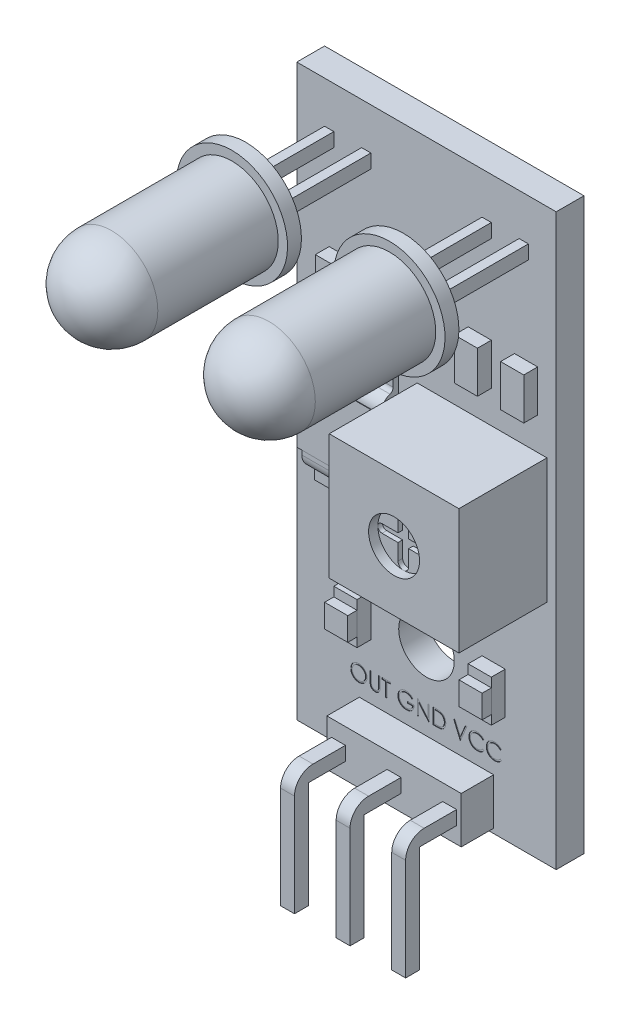
from build123d import *

# Parameters (mm, degrees)
SKETCH1_W               = 14.224
SKETCH1_H               = 31.242
BOSS_EXTRUDE1_DEPTH     = 0.762
SKETCH2_W               = 7.366
SKETCH2_H               = 2.54
BOSS_EXTRUDE2_DEPTH     = 1.778
BOSS_EXTRUDE3_START     = -4.318
SKETCH5_W               = 0.762
SKETCH5_H               = 0.762
BOSS_EXTRUDE3_DEPTH     = 6.35
SKETCH6_W               = 0.762
SKETCH6_H               = 0.762
BOSS_EXTRUDE4_DEPTH     = 6.604
LPATTERN1_COUNT         = 3
LPATTERN1_PITCH         = 3.048
CUT_EXTRUDE1_DEPTH      = 0.0254
CUT_EXTRUDE2_DEPTH      = 23.008773919
CUT_EXTRUDE2_DEPTH_BACK = 23.008773919
SKETCH8_R               = 1.524
SKETCH9_W               = 1.27
SKETCH9_H               = 2.286
BOSS_EXTRUDE5_DEPTH     = 0.762
SKETCH10_W              = 1.27
SKETCH10_H              = 1.27
BOSS_EXTRUDE6_DEPTH     = 0.508
LPATTERN2_START         = 3.048
LPATTERN2_OUTLINE_W     = 1.27
LPATTERN2_OUTLINE_H     = 0.508
LPATTERN2_DEPTH         = 1.27
LPATTERN2_START_2       = -9.779
LPATTERN2_2_OUTLINE_W   = 1.27
LPATTERN2_2_OUTLINE_H   = 0.762
LPATTERN2_2_DEPTH       = 2.286
SKETCH12_W              = 2.286
SKETCH12_H              = 1.27
BOSS_EXTRUDE7_DEPTH     = 0.762
LPATTERN3_COUNT         = 2
LPATTERN3_PITCH         = 5.842
SKETCH16_W              = 7.112
SKETCH16_H              = 6.858
BOSS_EXTRUDE9_DEPTH     = 4.826
SKETCH17_R              = 1.397
CUT_EXTRUDE3_DEPTH      = 0.508
CUT_EXTRUDE4_DEPTH      = 0.254
SKETCH19_W              = 1.27
SKETCH19_H              = 2.286
BOSS_EXTRUDE10_DEPTH    = 0.762
LPATTERN4_COUNT         = 5
LPATTERN4_PITCH         = 2.54
BOSS_EXTRUDE11_START    = -2.794
SKETCH20_W              = 0.508
SKETCH20_H              = 0.762
BOSS_EXTRUDE11_DEPTH    = 8.382
FILLET2_R               = 1.016
SKETCH31_W              = 4.826
SKETCH31_H              = 3.81
BOSS_EXTRUDE14_DEPTH    = 1.016
SKETCH32_W              = 4.318
SKETCH32_H              = 7.112
BOSS_EXTRUDE15_DEPTH    = 0.9906
SKETCH33_W              = 4.318
SKETCH33_H              = 0.762
CUT_EXTRUDE5_DEPTH      = 0.6858
FILLET4_R               = 0.762
FILLET5_R               = 0.254


with BuildPart() as part:
    # Sketch1 → Boss-Extrude1 (new, symmetric)
    with BuildSketch(Plane.XY):
        Rectangle(SKETCH1_W, SKETCH1_H)
    extrude(amount=BOSS_EXTRUDE1_DEPTH, both=True)

    # Sketch2 → Boss-Extrude2 (add)
    with BuildSketch(Plane.XY.offset(0.762)):
        with Locations((0, -14.097)):
            Rectangle(SKETCH2_W, SKETCH2_H)
    extrude(amount=BOSS_EXTRUDE2_DEPTH)

    # Sketch5 → Boss-Extrude3 (add)
    with BuildSketch(Plane.XY.offset(2.54).offset(BOSS_EXTRUDE3_START)):
        with Locations((-3.048, -14.097)):
            Rectangle(SKETCH5_W, SKETCH5_H)
    boss_extrude3 = extrude(amount=BOSS_EXTRUDE3_DEPTH)

    # Sketch6 → Boss-Extrude4 (add)
    with BuildSketch(Plane(origin=(0, -13.716, 0), x_dir=(1, 0, 0), z_dir=(0, 1, 0))):
        with Locations((-3.048, -4.953)):
            Rectangle(SKETCH6_W, SKETCH6_H)
    boss_extrude4 = extrude(amount=-BOSS_EXTRUDE4_DEPTH)

    # LPattern1: Boss-Extrude3, Boss-Extrude4 ×3
    with Locations(*[(i * LPATTERN1_PITCH, 0, 0) for i in range(1, LPATTERN1_COUNT)]):
        add(boss_extrude3)
        add(boss_extrude4)

    # Sketch7 → Cut-Extrude1 (cut)
    # profile 1 of 9: a face of its own
    with BuildSketch(Plane.XY.offset(0.762)):
        with BuildLine():
            add(Edge.make_bspline(
                [(-3.713008127, -11.244319932), (-3.697330739, -11.244717014), (-3.666539056, -11.245496915), (-3.621284752, -11.251466907), (-3.578081752, -11.261795124), (-3.536578123, -11.275550549), (-3.497270302, -11.293900084), (-3.459862421, -11.316079156), (-3.424443486, -11.342320125), (-3.391490888, -11.372420145), (-3.361335781, -11.405170043), (-3.334768379, -11.440119934), (-3.312502912, -11.477058498), (-3.294218352, -11.515874733), (-3.279873738, -11.556480855), (-3.269975227, -11.599093343), (-3.263652285, -11.643436099), (-3.262913078, -11.67368069), (-3.262538087, -11.689023413)],
                knots=[0, 0, 0, 0, 1.065120563, 2.091984664, 3.0946048, 4.079830382, 5.057816894, 6.036188127, 7.030412546, 8.04752943, 9.064399622, 10.05169764, 11.02544977, 11.989514704, 12.962713494, 13.945757189, 14.957906945, 16, 16, 16, 16], degree=3))
            add(Edge.make_bspline(
                [(-3.262538087, -11.689023413), (-3.262913023, -11.704253118), (-3.263652065, -11.73427263), (-3.269982416, -11.778333992), (-3.279910429, -11.820689261), (-3.294085143, -11.861267729), (-3.312282543, -11.900112202), (-3.334696268, -11.937120471), (-3.361098044, -11.972304668), (-3.391144269, -12.005279348), (-3.423898423, -12.035516828), (-3.459030312, -12.06186482), (-3.495749836, -12.08453713), (-3.534529514, -12.102627655), (-3.574855042, -12.117086766), (-3.617087333, -12.12694502), (-3.661028495, -12.133303981), (-3.690993478, -12.134034174), (-3.70622394, -12.134405313)],
                knots=[0, 0, 0, 0, 1.043624062, 2.057103931, 3.04512605, 4.022047818, 4.998200453, 5.980619268, 6.982898556, 8.009068085, 9.034988726, 10.034168286, 11.015286542, 11.987931943, 12.962482838, 13.94673481, 14.956375938, 16, 16, 16, 16], degree=3))
            add(Edge.make_bspline(
                [(-3.70622394, -12.134405313), (-3.721566583, -12.134030509), (-3.751811017, -12.133291671), (-3.796209495, -12.126958265), (-3.838851917, -12.117054369), (-3.879616337, -12.10290066), (-3.918525487, -12.084608493), (-3.955655465, -12.062303817), (-3.990857237, -12.035837711), (-4.023838951, -12.005801229), (-4.054016373, -11.97310259), (-4.080325781, -11.938066497), (-4.102635473, -11.901380324), (-4.12086622, -11.86294226), (-4.135299336, -11.822938124), (-4.145146024, -11.781101068), (-4.151516816, -11.737669611), (-4.152250959, -11.708098475), (-4.152623468, -11.693093926)],
                knots=[0, 0, 0, 0, 1.053102029, 2.075944431, 3.073151272, 4.055350789, 5.033113405, 6.020478099, 7.024410459, 8.052272461, 9.079885166, 10.07527673, 11.055994387, 12.023226415, 12.992069828, 13.970394897, 14.97016774, 16, 16, 16, 16], degree=3))
            add(Edge.make_bspline(
                [(-4.152623468, -11.693093926), (-4.152494137, -11.683022786), (-4.152237107, -11.663007558), (-4.149142736, -11.633285545), (-4.144652572, -11.604041522), (-4.138217444, -11.575358648), (-4.129801175, -11.547307137), (-4.119870495, -11.519693526), (-4.107741429, -11.492797657), (-4.094030111, -11.466492115), (-4.07872678, -11.441186967), (-4.061823505, -11.417267527), (-4.043913999, -11.394533079), (-4.024280189, -11.373572758), (-4.003569166, -11.353776809), (-3.981444951, -11.335449449), (-3.958042544, -11.318425415), (-3.933261247, -11.303083734), (-3.907711685, -11.289208288), (-3.881373877, -11.277301289), (-3.854605528, -11.267081766), (-3.827281264, -11.258798748), (-3.799473643, -11.252259571), (-3.771121977, -11.247806745), (-3.74224885, -11.244704481), (-3.722796971, -11.244448667), (-3.713008127, -11.244319932)],
                knots=[0, 0, 0, 0, 1.037015668, 2.060948919, 3.074880161, 4.083647147, 5.086022904, 6.090072063, 7.104153813, 8.122640571, 9.144368836, 10.147691507, 11.138137339, 12.123020368, 13.103399296, 14.087645067, 15.080126199, 16.082011238, 17.087798457, 18.072939717, 19.057185487, 20.037253025, 21.01195951, 21.997135196, 22.992090687, 24, 24, 24, 24], degree=3))
        make_face()
        with BuildLine():
            add(Edge.make_bspline(
                [(-3.709276824, -11.33115753), (-3.717311601, -11.331255475), (-3.733304343, -11.331450428), (-3.757079838, -11.33401842), (-3.780542646, -11.337678412), (-3.803697613, -11.342899084), (-3.826447856, -11.350012064), (-3.849005435, -11.35819834), (-3.871164647, -11.368169917), (-3.89285234, -11.379436075), (-3.913877509, -11.391906003), (-3.93371677, -11.405687743), (-3.952421484, -11.420458097), (-3.969945853, -11.436251534), (-3.986238421, -11.453148484), (-4.001619861, -11.470892786), (-4.015473644, -11.489991622), (-4.028170154, -11.50992709), (-4.039531897, -11.530673223), (-4.049635134, -11.552011606), (-4.05789957, -11.574116302), (-4.064639611, -11.596747496), (-4.070227564, -11.619869346), (-4.07376758, -11.643657253), (-4.076363789, -11.667991687), (-4.076547599, -11.68443682), (-4.076640569, -11.692754716)],
                knots=[0, 0, 0, 0, 1.008559885, 2.007477868, 2.99961109, 3.989939068, 4.984837346, 5.991145699, 7.001802488, 8.033829008, 9.059044045, 10.069351652, 11.065060232, 12.050310815, 13.029377138, 14.011219647, 14.996725999, 15.989392538, 16.977580475, 17.965360261, 18.951710183, 19.937753436, 20.929683414, 21.935841486, 22.955955122, 24, 24, 24, 24], degree=3))
            add(Edge.make_bspline(
                [(-4.076640569, -11.692754716), (-4.076332174, -11.704985957), (-4.075725466, -11.729048591), (-4.070413825, -11.764310596), (-4.06223213, -11.798198616), (-4.050171396, -11.830527227), (-4.035088487, -11.861574317), (-4.016455318, -11.891064465), (-3.994379312, -11.919005642), (-3.969302614, -11.94520278), (-3.941889315, -11.969114049), (-3.912780257, -11.990102528), (-3.882287292, -12.007860816), (-3.850330902, -12.022327946), (-3.817081691, -12.033791748), (-3.782325411, -12.041648483), (-3.746293589, -12.046819307), (-3.721732842, -12.047315878), (-3.709276824, -12.047567715)],
                knots=[0, 0, 0, 0, 1.032063989, 2.030389145, 3.003944642, 3.970395727, 4.937377036, 5.913328081, 6.909231446, 7.93887556, 8.970685674, 9.976071282, 10.964166581, 11.944589148, 12.933237628, 13.927779006, 14.949070134, 16, 16, 16, 16], degree=3))
            add(Edge.make_bspline(
                [(-3.709276824, -12.047567715), (-3.700904622, -12.047452688), (-3.68430003, -12.047224556), (-3.659602639, -12.044926781), (-3.635350187, -12.041242119), (-3.611576689, -12.03593699), (-3.588309127, -12.029297381), (-3.565450387, -12.021409417), (-3.543243945, -12.011568441), (-3.521409663, -12.000695318), (-3.500510003, -11.988300081), (-3.480558781, -11.974986092), (-3.462058879, -11.960237494), (-3.44454762, -11.944678711), (-3.428188161, -11.927996029), (-3.413091132, -11.910211139), (-3.399307368, -11.891211782), (-3.38661568, -11.871306552), (-3.375293749, -11.850503651), (-3.365429092, -11.829087903), (-3.357060127, -11.807112041), (-3.35030409, -11.784544367), (-3.345009893, -11.761427745), (-3.341361989, -11.737731222), (-3.338810272, -11.713502203), (-3.338617939, -11.697114643), (-3.338520985, -11.688853809)],
                knots=[0, 0, 0, 0, 1.047197238, 2.076906641, 3.100256066, 4.114471768, 5.12198147, 6.126382909, 7.136867548, 8.15857795, 9.17633901, 10.174870724, 11.156907918, 12.133735059, 13.104061851, 14.077631395, 15.04955518, 16.038496417, 17.029181396, 18.010275684, 18.986308667, 19.968651475, 20.955262928, 21.950658345, 22.966943676, 24, 24, 24, 24], degree=3))
            add(Edge.make_bspline(
                [(-3.338520985, -11.688853809), (-3.338618016, -11.680649487), (-3.338810495, -11.664374705), (-3.34136077, -11.640314662), (-3.345013747, -11.616788649), (-3.350278249, -11.593889027), (-3.357063714, -11.571609957), (-3.365430553, -11.549972365), (-3.37529671, -11.528895642), (-3.386619842, -11.508431881), (-3.399347859, -11.488795327), (-3.413255988, -11.470022936), (-3.428584366, -11.452467246), (-3.444895041, -11.435694855), (-3.462595425, -11.420063481), (-3.481605338, -11.40556794), (-3.501693997, -11.391858406), (-3.522964012, -11.37949089), (-3.544915404, -11.368069544), (-3.567440112, -11.358284255), (-3.590282959, -11.349969476), (-3.613385856, -11.342877563), (-3.63694326, -11.337698859), (-3.660795993, -11.334015122), (-3.684911055, -11.331451322), (-3.701129127, -11.331255772), (-3.709276824, -11.33115753)],
                knots=[0, 0, 0, 0, 1.02996197, 2.043119294, 3.035359645, 4.018872909, 4.991431989, 5.957985074, 6.929999688, 7.912076566, 8.892894881, 9.867085534, 10.843653904, 11.817741046, 12.803660682, 13.806313499, 14.818574707, 15.856120519, 16.894564902, 17.924820532, 18.937903209, 19.946497019, 20.957711757, 21.963978472, 22.977135795, 24, 24, 24, 24], degree=3))
        make_face(mode=Mode.SUBTRACT)
    # profile 2 of 9: a face of its own
    with BuildSketch(Plane.XY.offset(0.762)):
        with BuildLine():
            Line((-3.08886289, -11.266029332), (-3.012879992, -11.266029332))
            Line((-3.012879992, -11.266029332), (-3.012879992, -11.773316941))
            add(Edge.make_bspline(
                [(-3.012879992, -11.773316941), (-3.0128913, -11.780496852), (-3.012912758, -11.794121969), (-3.012769426, -11.813515061), (-3.012368017, -11.830756207), (-3.012114946, -11.845911864), (-3.011551953, -11.85891249), (-3.011092806, -11.869828516), (-3.010502424, -11.878608256), (-3.009792889, -11.883732022), (-3.009487898, -11.885934451)],
                knots=[0, 0, 0, 0, 1.528628734, 2.90083645, 4.128790002, 5.200304208, 6.127813768, 6.898992206, 7.526736466, 8, 8, 8, 8], degree=3))
            add(Edge.make_bspline(
                [(-3.009487898, -11.885934451), (-3.008235447, -11.893880239), (-3.005801114, -11.909324098), (-2.999597134, -11.931315242), (-2.990932711, -11.95113485), (-2.980665538, -11.969401389), (-2.967135174, -11.985606432), (-2.950926701, -12.000534773), (-2.931289414, -12.013590809), (-2.909454946, -12.025529004), (-2.885921186, -12.035124175), (-2.86187313, -12.042379712), (-2.837672259, -12.046801465), (-2.821470408, -12.047313465), (-2.813424884, -12.047567715)],
                knots=[0, 0, 0, 0, 1.035780045, 2.013197591, 2.933192213, 3.817615948, 4.702609284, 5.640816605, 6.646850145, 7.73207398, 8.84249596, 9.914020372, 10.964143139, 12, 12, 12, 12], degree=3))
            add(Edge.make_bspline(
                [(-2.813424884, -12.047567715), (-2.806517599, -12.047307946), (-2.792742923, -12.046789907), (-2.772276227, -12.043581904), (-2.75234325, -12.037800244), (-2.732845564, -12.03033996), (-2.714569423, -12.020482925), (-2.69750463, -12.009096266), (-2.682273356, -11.995740493), (-2.668373994, -11.98096003), (-2.656270306, -11.964283166), (-2.645778621, -11.946073028), (-2.637184731, -11.926055569), (-2.632940869, -11.911987739), (-2.630760639, -11.904760571)],
                knots=[0, 0, 0, 0, 0.994687771, 1.983630487, 2.973142513, 3.978332533, 4.983357753, 5.956394766, 6.925816176, 7.893390482, 8.871859704, 9.88551698, 10.913711441, 12, 12, 12, 12], degree=3))
            add(Edge.make_bspline(
                [(-2.630760639, -11.904760571), (-2.630034895, -11.901773392), (-2.628417643, -11.895116755), (-2.626906454, -11.883863034), (-2.625332494, -11.870585037), (-2.624240398, -11.855187362), (-2.623175722, -11.837721604), (-2.62253877, -11.818096778), (-2.622244364, -11.796384144), (-2.622156629, -11.781231918), (-2.6221108, -11.773316941)],
                knots=[0, 0, 0, 0, 0.558680831, 1.244966039, 2.062412453, 2.990489873, 4.051219941, 5.244515665, 6.560634259, 8, 8, 8, 8], degree=3))
            Line((-2.6221108, -11.773316941), (-2.6221108, -11.266029332))
            Line((-2.6221108, -11.266029332), (-2.546127902, -11.266029332))
            Line((-2.546127902, -11.266029332), (-2.546127902, -11.777387454))
            add(Edge.make_bspline(
                [(-2.546127902, -11.777387454), (-2.546189375, -11.786603632), (-2.546309343, -11.804589564), (-2.547349673, -11.830945414), (-2.549008414, -11.85594699), (-2.551352008, -11.879597653), (-2.55445734, -11.901812771), (-2.557910583, -11.922787065), (-2.562308299, -11.942369977), (-2.567444759, -11.960714199), (-2.573316645, -11.978176216), (-2.580922408, -11.994748775), (-2.589491762, -12.010935685), (-2.599655306, -12.026492121), (-2.611075963, -12.041486962), (-2.624006178, -12.05582927), (-2.638018307, -12.069748238), (-2.653345284, -12.082886826), (-2.669734457, -12.094935781), (-2.687137074, -12.105530669), (-2.705419453, -12.114486858), (-2.72453407, -12.121859128), (-2.744489083, -12.127402278), (-2.765284994, -12.13153284), (-2.78696914, -12.133879871), (-2.801716779, -12.134228681), (-2.809184767, -12.134405313)],
                knots=[0, 0, 0, 0, 1.316592851, 2.569410997, 3.76748051, 4.895814652, 5.963796859, 6.97159953, 7.931736103, 8.829262218, 9.692595152, 10.560224239, 11.431080259, 12.30701507, 13.211635791, 14.121146779, 15.063487852, 16.031507147, 17.00238618, 17.966455255, 18.938106653, 19.907068911, 20.888905087, 21.893141452, 22.933117798, 24, 24, 24, 24], degree=3))
            add(Edge.make_bspline(
                [(-2.809184767, -12.134405313), (-2.817329482, -12.134215475), (-2.833309385, -12.133843012), (-2.856855924, -12.131708747), (-2.87942907, -12.127688679), (-2.901267233, -12.122569988), (-2.922073096, -12.115510304), (-2.942125413, -12.107261806), (-2.961080749, -12.097131498), (-2.979246616, -12.085860336), (-2.996137556, -12.073178568), (-3.011643021, -12.059356089), (-3.025788611, -12.044614323), (-3.038335895, -12.028793664), (-3.049492755, -12.012017158), (-3.059103682, -11.994237344), (-3.067355837, -11.975461105), (-3.071614949, -11.96240957), (-3.073768074, -11.955811581)],
                knots=[0, 0, 0, 0, 1.13879206, 2.234305948, 3.301075583, 4.341971843, 5.366689343, 6.369221514, 7.369726634, 8.367512178, 9.355451585, 10.318319045, 11.268648973, 12.207971039, 13.137398894, 14.081662264, 15.030215811, 16, 16, 16, 16], degree=3))
            add(Edge.make_bspline(
                [(-3.073768074, -11.955811581), (-3.075020453, -11.951304273), (-3.077736891, -11.941527821), (-3.080645867, -11.925347663), (-3.083091302, -11.90671739), (-3.085390742, -11.885635726), (-3.086747575, -11.862086332), (-3.087937127, -11.836079416), (-3.088871271, -11.807583531), (-3.088865762, -11.787734155), (-3.08886289, -11.777387454)],
                knots=[0, 0, 0, 0, 0.625038921, 1.35572334, 2.194682327, 3.136881307, 4.189498639, 5.346923369, 6.617055217, 8, 8, 8, 8], degree=3))
            Line((-3.08886289, -11.777387454), (-3.08886289, -11.266029332))
        make_face()
    # profile 3 of 9: a face of its own
    with BuildSketch(Plane.XY.offset(0.762)):
        Polygon((-2.426726205, -11.35286693), (-2.426726205, -11.266029332), (-1.981683514, -11.266029332), (-1.981683514, -11.35286693), (-2.16621341, -11.35286693), (-2.16621341, -12.112695914), (-2.242196308, -12.112695914), (-2.242196308, -11.35286693), align=None)
    # profile 4 of 9: a face of its own
    with BuildSketch(Plane.XY.offset(0.762)):
        with BuildLine():
            Line((-0.733393041, -11.410532522), (-0.798521239, -11.472268627))
            add(Edge.make_bspline(
                [(-0.798521239, -11.472268627), (-0.810306569, -11.461181924), (-0.833596201, -11.439272887), (-0.871565627, -11.410846421), (-0.911180826, -11.386494814), (-0.952235083, -11.366681308), (-0.99371172, -11.350872165), (-1.0350602, -11.339616788), (-1.075856395, -11.33243886), (-1.102990176, -11.331580493), (-1.116360417, -11.33115753)],
                knots=[0, 0, 0, 0, 1.08915593, 2.152340314, 3.188132944, 4.216796309, 5.218260357, 6.173443236, 7.099959455, 8, 8, 8, 8], degree=3))
            add(Edge.make_bspline(
                [(-1.116360417, -11.33115753), (-1.124564543, -11.331257583), (-1.140951519, -11.33145743), (-1.165292444, -11.334008126), (-1.189378085, -11.337676578), (-1.213162975, -11.342984423), (-1.23669336, -11.349711566), (-1.259887402, -11.358126334), (-1.282788368, -11.36793684), (-1.305180541, -11.379273094), (-1.326889194, -11.391726313), (-1.347392274, -11.405526625), (-1.366820466, -11.420231722), (-1.384808605, -11.436209767), (-1.401460163, -11.453316027), (-1.417171482, -11.471232292), (-1.431389988, -11.490448048), (-1.444232992, -11.51060975), (-1.455689992, -11.531363287), (-1.465803704, -11.552508903), (-1.474293856, -11.573976462), (-1.481011418, -11.595792901), (-1.486553614, -11.617789442), (-1.49045254, -11.640118391), (-1.492650661, -11.662803657), (-1.493030882, -11.677994612), (-1.493222024, -11.68563132)],
                knots=[0, 0, 0, 0, 1.02818874, 2.053710826, 3.065248034, 4.081641283, 5.106893873, 6.131558223, 7.173050175, 8.228653731, 9.27666206, 10.308777013, 11.325269123, 12.329503258, 13.32196095, 14.316845687, 15.314881793, 16.315733098, 17.311955233, 18.285320748, 19.252783886, 20.203351036, 21.145449891, 22.095197417, 23.042428769, 24, 24, 24, 24], degree=3))
            add(Edge.make_bspline(
                [(-1.493222024, -11.68563132), (-1.493039213, -11.693437783), (-1.492674088, -11.709029393), (-1.490337211, -11.732299195), (-1.486000285, -11.755223395), (-1.480202382, -11.777877322), (-1.472949881, -11.800299774), (-1.463909256, -11.822393541), (-1.453201198, -11.844157805), (-1.440806833, -11.865396464), (-1.427215124, -11.886084889), (-1.411988895, -11.905572619), (-1.395815003, -11.924119159), (-1.378104213, -11.941312723), (-1.35942444, -11.957613207), (-1.339217587, -11.972571513), (-1.317880994, -11.986475767), (-1.295382109, -11.999150734), (-1.271965057, -12.01047394), (-1.247954378, -12.020542958), (-1.223273366, -12.028835292), (-1.198051728, -12.035593652), (-1.172319529, -12.041133342), (-1.145946155, -12.044697199), (-1.119125521, -12.047283362), (-1.101045892, -12.047472451), (-1.091937342, -12.047567715)],
                knots=[0, 0, 0, 0, 0.93586088, 1.869166235, 2.799637598, 3.729985548, 4.670839027, 5.622275134, 6.589130586, 7.576015415, 8.568469353, 9.55398029, 10.53834874, 11.515998671, 12.510579167, 13.508179873, 14.527009472, 15.561807829, 16.601455013, 17.643573243, 18.680854198, 19.719860599, 20.772568776, 21.833555941, 22.908541556, 24, 24, 24, 24], degree=3))
            add(Edge.make_bspline(
                [(-1.091937342, -12.047567715), (-1.080960105, -12.04733825), (-1.059404516, -12.046887658), (-1.027718275, -12.043379969), (-0.997285917, -12.037901602), (-0.968192952, -12.029878615), (-0.940405592, -12.019645156), (-0.913821969, -12.00730913), (-0.88865138, -11.992397382), (-0.864818157, -11.975567134), (-0.842863564, -11.956815929), (-0.823062663, -11.936581939), (-0.80573128, -11.91496338), (-0.790611097, -11.892087582), (-0.778102529, -11.867765196), (-0.767835416, -11.842115417), (-0.759965458, -11.815126708), (-0.756734827, -11.796477877), (-0.75510244, -11.787054921)],
                knots=[0, 0, 0, 0, 1.13008108, 2.219097802, 3.278683437, 4.311054135, 5.322181354, 6.324827112, 7.324222904, 8.330512327, 9.32562643, 10.293043162, 11.24128371, 12.174520618, 13.111833804, 14.052305215, 15.015860969, 16, 16, 16, 16], degree=3))
            Line((-0.75510244, -11.787054921), (-1.037324634, -11.787054921))
            Line((-1.037324634, -11.787054921), (-1.037324634, -11.700217322))
            Line((-1.037324634, -11.700217322), (-0.679119542, -11.700217322))
            add(Edge.make_bspline(
                [(-0.679119542, -11.700217322), (-0.679532194, -11.716402561), (-0.680339831, -11.748079996), (-0.686004977, -11.79427661), (-0.695152971, -11.837909377), (-0.707649845, -11.879024249), (-0.723827292, -11.917562962), (-0.743511692, -11.953564644), (-0.767018089, -11.986796714), (-0.793509183, -12.01753047), (-0.823239265, -12.044945343), (-0.855405004, -12.069040492), (-0.890059544, -12.089336932), (-0.927170103, -12.105849509), (-0.966615194, -12.118736741), (-1.008486094, -12.127873864), (-1.052726019, -12.13334816), (-1.083045555, -12.134047598), (-1.098551925, -12.134405313)],
                knots=[0, 0, 0, 0, 1.140356446, 2.231883559, 3.274166699, 4.278491846, 5.25512956, 6.21435461, 7.1637429, 8.11826594, 9.068280886, 10.0076534, 10.945064095, 11.891975133, 12.864533718, 13.863980011, 14.907571808, 16, 16, 16, 16], degree=3))
            add(Edge.make_bspline(
                [(-1.098551925, -12.134405313), (-1.108109614, -12.13426764), (-1.126960457, -12.133996104), (-1.154801498, -12.132066346), (-1.1818749, -12.129095617), (-1.208176721, -12.124609463), (-1.233803708, -12.119114681), (-1.258627871, -12.112078466), (-1.282743776, -12.103933848), (-1.306188696, -12.094669943), (-1.328749832, -12.083936229), (-1.350527673, -12.072007994), (-1.3716426, -12.058946744), (-1.391950785, -12.044526598), (-1.41155804, -12.028855414), (-1.430337937, -12.011901782), (-1.448395613, -11.993717532), (-1.45970719, -11.980804896), (-1.465406856, -11.974298492)],
                knots=[0, 0, 0, 0, 1.107784379, 2.184907829, 3.233506516, 4.263428166, 5.276301166, 6.270063455, 7.25232949, 8.225834625, 9.190232166, 10.146266622, 11.1027726, 12.066435141, 13.031522626, 14.010570082, 14.99756817, 16, 16, 16, 16], degree=3))
            add(Edge.make_bspline(
                [(-1.465406856, -11.974298492), (-1.473676595, -11.963976258), (-1.490078804, -11.943503131), (-1.511191803, -11.910700862), (-1.529189855, -11.876736986), (-1.543793117, -11.841516956), (-1.555196044, -11.805073714), (-1.563373936, -11.767453828), (-1.568165414, -11.728608855), (-1.568855698, -11.702322212), (-1.569204923, -11.689023413)],
                knots=[0, 0, 0, 0, 1.023165419, 2.029347347, 3.013907458, 3.994755782, 4.975994455, 5.96558838, 6.970761222, 8, 8, 8, 8], degree=3))
            add(Edge.make_bspline(
                [(-1.569204923, -11.689023413), (-1.569076172, -11.679065102), (-1.568820306, -11.659275043), (-1.565717753, -11.629893944), (-1.561266363, -11.601034542), (-1.554723552, -11.572720425), (-1.546475504, -11.544932685), (-1.536181614, -11.517658418), (-1.524196469, -11.49088153), (-1.510266265, -11.46478633), (-1.494763931, -11.439719094), (-1.477939403, -11.415780733), (-1.459553772, -11.39340719), (-1.439907285, -11.372315117), (-1.418765539, -11.352769493), (-1.396326595, -11.334589357), (-1.37257316, -11.317750324), (-1.347430506, -11.302517622), (-1.321273907, -11.288834615), (-1.294166062, -11.276838749), (-1.266115245, -11.266924691), (-1.237331611, -11.258512749), (-1.207597285, -11.252292135), (-1.177128044, -11.247780915), (-1.145765067, -11.244694065), (-1.124565497, -11.244445809), (-1.113816346, -11.244319932)],
                knots=[0, 0, 0, 0, 1.008945113, 2.00506715, 2.99143336, 3.967273523, 4.948097931, 5.927297278, 6.919902385, 7.919676788, 8.923139349, 9.905703106, 10.883022732, 11.856032218, 12.825136022, 13.798837087, 14.781400844, 15.773989409, 16.776158564, 17.77167057, 18.775803737, 19.789618931, 20.80898985, 21.851988756, 22.910860228, 24, 24, 24, 24], degree=3))
            add(Edge.make_bspline(
                [(-1.113816346, -11.244319932), (-1.105050144, -11.244460114), (-1.087667794, -11.244738078), (-1.061801952, -11.246664764), (-1.036335911, -11.249718541), (-1.011231911, -11.253885782), (-0.98657544, -11.25956176), (-0.962296259, -11.26635403), (-0.938359171, -11.274262337), (-0.914839197, -11.283693923), (-0.89157819, -11.294399085), (-0.868446814, -11.306449188), (-0.845524103, -11.320050283), (-0.822770306, -11.335242756), (-0.800041939, -11.351765676), (-0.777698494, -11.37009161), (-0.755200642, -11.389497875), (-0.740734299, -11.403451469), (-0.733393041, -11.410532522)],
                knots=[0, 0, 0, 0, 0.985871117, 1.954866573, 2.915460327, 3.869826059, 4.81536089, 5.759505086, 6.70452669, 7.649098992, 8.607881297, 9.583363685, 10.581137262, 11.603961102, 12.659522466, 13.73993555, 14.853081303, 16, 16, 16, 16], degree=3))
        make_face()
    # profile 5 of 9: a face of its own
    with BuildSketch(Plane.XY.offset(0.762)):
        Polygon((-0.505444345, -12.112695914), (-0.505444345, -11.266029332), (-0.489501505, -11.266029332), (0.069854742, -11.932406135), (0.069854742, -11.266029332), (0.145837641, -11.266029332), (0.145837641, -12.112695914), (0.128537963, -12.112695914), (-0.429461447, -11.447845553), (-0.429461447, -12.112695914), align=None)
    # profile 6 of 9: a face of its own
    with BuildSketch(Plane.XY.offset(0.762)):
        with BuildLine():
            Line((0.362931636, -12.112695914), (0.362931636, -11.266029332))
            Line((0.362931636, -11.266029332), (0.533893158, -11.266029332))
            add(Edge.make_bspline(
                [(0.533893158, -11.266029332), (0.548762797, -11.266136391), (0.577490863, -11.26634323), (0.619004727, -11.267654691), (0.657415272, -11.26997467), (0.692596169, -11.273353964), (0.724644002, -11.277503364), (0.753469034, -11.282704414), (0.779220312, -11.288845933), (0.795057679, -11.29408207), (0.802546977, -11.296558175)],
                knots=[0, 0, 0, 0, 1.314313732, 2.53924729, 3.670748893, 4.714932338, 5.66265055, 6.526160246, 7.303039223, 8, 8, 8, 8], degree=3))
            add(Edge.make_bspline(
                [(0.802546977, -11.296558175), (0.812342846, -11.300290935), (0.831712447, -11.30767181), (0.85929131, -11.321594952), (0.885253824, -11.337370311), (0.909739214, -11.35501868), (0.932188174, -11.375039768), (0.953477701, -11.396583098), (0.97273688, -11.420432085), (0.990373742, -11.446092127), (1.00627551, -11.473260945), (1.020097743, -11.501886768), (1.031577089, -11.531824223), (1.041106497, -11.562990056), (1.048616782, -11.595452795), (1.053740792, -11.629250242), (1.05712044, -11.664248823), (1.057460087, -11.687997691), (1.057632421, -11.700047718)],
                knots=[0, 0, 0, 0, 0.984719456, 1.947108742, 2.898477687, 3.838006223, 4.779231079, 5.722358779, 6.681677486, 7.655904652, 8.64651281, 9.637519902, 10.640069247, 11.656948941, 12.698408672, 13.768548281, 14.867775369, 16, 16, 16, 16], degree=3))
            add(Edge.make_bspline(
                [(1.057632421, -11.700047718), (1.057480271, -11.710512816), (1.057180443, -11.731135386), (1.054488209, -11.761528514), (1.050575081, -11.791019984), (1.044516771, -11.81946936), (1.037162258, -11.847125898), (1.027736646, -11.873694838), (1.016939108, -11.89941991), (1.004347995, -11.923953277), (0.990525224, -11.9471963), (0.975691203, -11.96910695), (0.959861757, -11.989372573), (0.942885939, -12.00805454), (0.924983122, -12.025124688), (0.906036095, -12.040725612), (0.885995968, -12.054552053), (0.8649525, -12.067147333), (0.842291801, -12.078134733), (0.817584651, -12.087431134), (0.790725683, -12.095134981), (0.761780824, -12.101562607), (0.730700062, -12.106661306), (0.697452925, -12.110078547), (0.662090495, -12.112389447), (0.637808275, -12.112591774), (0.625310082, -12.112695914)],
                knots=[0, 0, 0, 0, 1.105936401, 2.179363191, 3.223086493, 4.248585256, 5.251745608, 6.245858792, 7.225916811, 8.198733463, 9.158002045, 10.082870192, 10.993790845, 11.873723703, 12.748670949, 13.606408763, 14.465103618, 15.319838547, 16.196477973, 17.123216899, 18.106603292, 19.147568657, 20.255746949, 21.433717677, 22.679120308, 24, 24, 24, 24], degree=3))
            Line((0.625310082, -12.112695914), (0.362931636, -12.112695914))
        make_face()
        with BuildLine():
            Line((0.438914535, -12.025858315), (0.536098018, -12.025858315))
            add(Edge.make_bspline(
                [(0.536098018, -12.025858315), (0.550062785, -12.0257983), (0.576922145, -12.025682868), (0.615544171, -12.024669963), (0.650833088, -12.023014866), (0.682793907, -12.02069861), (0.711408582, -12.017634012), (0.736736916, -12.014217131), (0.758695881, -12.009960224), (0.771983572, -12.006101611), (0.778123902, -12.004318521)],
                knots=[0, 0, 0, 0, 1.375205317, 2.645023457, 3.804390687, 4.853969522, 5.800190428, 6.637939096, 7.370582563, 8, 8, 8, 8], degree=3))
            add(Edge.make_bspline(
                [(0.778123902, -12.004318521), (0.785852363, -12.001596715), (0.801124689, -11.996218115), (0.823109254, -11.986407025), (0.843612375, -11.97478542), (0.862991369, -11.961867157), (0.880971339, -11.947196602), (0.897765362, -11.931092765), (0.913339625, -11.913473687), (0.927533218, -11.894361239), (0.940235226, -11.873874376), (0.951234931, -11.852214508), (0.960875206, -11.829618958), (0.968441645, -11.805740745), (0.974372081, -11.780793337), (0.978572682, -11.754774979), (0.981188815, -11.727690531), (0.981493965, -11.709268971), (0.981649523, -11.699878113)],
                knots=[0, 0, 0, 0, 0.998632004, 1.973411704, 2.929992603, 3.868527914, 4.809262121, 5.754881198, 6.702106254, 7.672490631, 8.653608572, 9.636854334, 10.631411391, 11.644891563, 12.686317036, 13.754757253, 14.855430412, 16, 16, 16, 16], degree=3))
            add(Edge.make_bspline(
                [(0.981649523, -11.699878113), (0.981525356, -11.68997611), (0.98128143, -11.670523538), (0.978215454, -11.64198103), (0.973735002, -11.614529523), (0.967255902, -11.588167181), (0.95899948, -11.562842573), (0.948695635, -11.53869576), (0.936922949, -11.515471728), (0.922915857, -11.493706502), (0.907575325, -11.473122076), (0.890550582, -11.454264413), (0.87211211, -11.437090555), (0.852461015, -11.421333047), (0.831043471, -11.407625835), (0.80836401, -11.395364487), (0.784089916, -11.384958739), (0.767201894, -11.379424234), (0.758619364, -11.376611585)],
                knots=[0, 0, 0, 0, 1.122418816, 2.205001699, 3.251619955, 4.274784885, 5.280384055, 6.268708349, 7.249350384, 8.229342522, 9.199999885, 10.157847722, 11.105861043, 12.055065948, 13.010012805, 13.98527497, 14.976112212, 16, 16, 16, 16], degree=3))
            add(Edge.make_bspline(
                [(0.758619364, -11.376611585), (0.751519182, -11.374648183), (0.736422249, -11.370473451), (0.7117868, -11.365919504), (0.684060852, -11.361902797), (0.653121309, -11.358502091), (0.619003437, -11.35606192), (0.581680998, -11.354230383), (0.54113786, -11.352995065), (0.513032754, -11.352910711), (0.498445779, -11.35286693)],
                knots=[0, 0, 0, 0, 0.674548936, 1.434276114, 2.292660221, 3.240891867, 4.284742987, 5.42552168, 6.663806718, 8, 8, 8, 8], degree=3))
            Line((0.498445779, -11.35286693), (0.438914535, -11.35286693))
            Line((0.438914535, -11.35286693), (0.438914535, -12.025858315))
        make_face(mode=Mode.SUBTRACT)
    # profile 7 of 9: a face of its own
    with BuildSketch(Plane.XY.offset(0.762)):
        Polygon((1.491820412, -11.266029332), (1.57323066, -11.266029332), (1.855452854, -11.933254158), (2.137675048, -11.266029332), (2.219085297, -11.266029332), (1.860880204, -12.112695914), (1.850025505, -12.112695914), align=None)
    # profile 8 of 9: a face of its own
    with BuildSketch(Plane.XY.offset(0.762)):
        with BuildLine():
            Line((3.152589477, -11.421387222), (3.086104441, -11.472268627))
            add(Edge.make_bspline(
                [(3.086104441, -11.472268627), (3.081361684, -11.466616288), (3.071940112, -11.455387817), (3.056782554, -11.439620576), (3.040985777, -11.4248486), (3.02455582, -11.411001518), (3.007196949, -11.398563559), (2.989329672, -11.38688655), (2.970655099, -11.37641988), (2.944831348, -11.363728835), (2.911049872, -11.35048548), (2.868524268, -11.339381271), (2.824132064, -11.33231253), (2.793846171, -11.33154694), (2.778441544, -11.33115753)],
                knots=[0, 0, 0, 0, 0.757959112, 1.505699292, 2.245454638, 2.979532153, 3.711538275, 4.438200793, 5.171680507, 5.909471876, 7.393775596, 8.890124382, 10.418191784, 12, 12, 12, 12], degree=3))
            add(Edge.make_bspline(
                [(2.778441544, -11.33115753), (2.769954728, -11.331255251), (2.753059861, -11.331449785), (2.727986804, -11.334016182), (2.703381935, -11.337623275), (2.679261259, -11.342975495), (2.655655479, -11.349742204), (2.632410272, -11.35782797), (2.609862186, -11.367831902), (2.5876993, -11.378888947), (2.566465093, -11.39137787), (2.546373684, -11.405000337), (2.527498348, -11.419603907), (2.509824156, -11.435243316), (2.493333039, -11.451848131), (2.478144491, -11.469595313), (2.46431107, -11.488428123), (2.451558571, -11.508098221), (2.440137588, -11.528548314), (2.430575122, -11.549854091), (2.422107218, -11.5716507), (2.41540664, -11.594184407), (2.410102995, -11.617296655), (2.406443542, -11.641049472), (2.403906331, -11.665393235), (2.403712764, -11.681893391), (2.403615193, -11.690210646)],
                knots=[0, 0, 0, 0, 1.054917814, 2.100044995, 3.131103042, 4.146048494, 5.169673617, 6.183595914, 7.203665975, 8.234915748, 9.262203917, 10.264457458, 11.251630812, 12.227803204, 13.197192746, 14.159520551, 15.12972552, 16.100847026, 17.073214652, 18.039054194, 19.002613845, 19.979014051, 20.95965708, 21.949030935, 22.966165397, 24, 24, 24, 24], degree=3))
            add(Edge.make_bspline(
                [(2.403615193, -11.690210646), (2.403920433, -11.702724697), (2.404519731, -11.727294377), (2.409853328, -11.763282693), (2.417958368, -11.797759119), (2.430105754, -11.830508144), (2.445084265, -11.861933592), (2.46401104, -11.891503749), (2.48593161, -11.919665468), (2.511156086, -11.945753188), (2.538831395, -11.969584125), (2.568524696, -11.990569501), (2.600162035, -12.008062814), (2.633394093, -12.022619661), (2.668476597, -12.033809382), (2.70534646, -12.041686798), (2.743923491, -12.046825382), (2.770283705, -12.047317341), (2.783699289, -12.047567715)],
                knots=[0, 0, 0, 0, 1.029171465, 2.020641659, 2.987623507, 3.938342917, 4.889210282, 5.84687017, 6.821220943, 7.821438502, 8.827599549, 9.822697543, 10.807740252, 11.797342354, 12.80366471, 13.83203677, 14.896651826, 16, 16, 16, 16], degree=3))
            add(Edge.make_bspline(
                [(2.783699289, -12.047567715), (2.798480319, -12.047159191), (2.827572922, -12.046355119), (2.870237183, -12.039543263), (2.911079355, -12.028498396), (2.950101634, -12.013041186), (2.987194011, -11.992947299), (3.022414533, -11.968588006), (3.055792929, -11.939731593), (3.075864075, -11.917698153), (3.086104441, -11.906456618)],
                knots=[0, 0, 0, 0, 1.028121516, 2.023589091, 2.998037872, 3.967518031, 4.937445131, 5.927275754, 6.942489185, 8, 8, 8, 8], degree=3))
            Line((3.086104441, -11.906456618), (3.152589477, -11.956829209))
            add(Edge.make_bspline(
                [(3.152589477, -11.956829209), (3.147239001, -11.963732796), (3.136563679, -11.977506901), (3.119277646, -11.996925008), (3.101067711, -12.015189792), (3.081798617, -12.032153996), (3.06169203, -12.048157075), (3.04038692, -12.062744373), (3.018163366, -12.0761195), (2.995096666, -12.088366393), (2.971211327, -12.099232088), (2.946535971, -12.108534237), (2.921176958, -12.116547304), (2.89513313, -12.123139677), (2.868350463, -12.128285253), (2.840925609, -12.13172506), (2.812799375, -12.134081675), (2.793824024, -12.134296466), (2.784208103, -12.134405313)],
                knots=[0, 0, 0, 0, 0.986787822, 1.968848986, 2.935600012, 3.899624008, 4.868462664, 5.837806735, 6.815139263, 7.798259679, 8.787526145, 9.778297419, 10.776456485, 11.791383307, 12.812564526, 13.85620153, 14.913611965, 16, 16, 16, 16], degree=3))
            add(Edge.make_bspline(
                [(2.784208103, -12.134405313), (2.775101922, -12.134341936), (2.757095576, -12.134216615), (2.730510547, -12.13218651), (2.704629261, -12.129416765), (2.679525687, -12.125246295), (2.655062835, -12.120324903), (2.631462467, -12.113727857), (2.608492352, -12.106337869), (2.586244774, -12.097652282), (2.564700811, -12.087851226), (2.543929948, -12.076774031), (2.523941739, -12.064513848), (2.504539668, -12.051340922), (2.486010349, -12.036832129), (2.468193213, -12.021188964), (2.450988349, -12.004464151), (2.440343891, -11.992404026), (2.434992059, -11.986340424)],
                knots=[0, 0, 0, 0, 1.114604814, 2.203992996, 3.262667896, 4.300477797, 5.318619304, 6.316056647, 7.298880507, 8.271930387, 9.238335007, 10.195173496, 11.151986948, 12.108099108, 13.064862484, 14.031167946, 15.010108607, 16, 16, 16, 16], degree=3))
            add(Edge.make_bspline(
                [(2.434992059, -11.986340424), (2.426420009, -11.975807604), (2.409379398, -11.954869126), (2.387577569, -11.920933282), (2.36891521, -11.885501929), (2.353826179, -11.848388921), (2.342030243, -11.809677538), (2.333858411, -11.769348265), (2.328548214, -11.727438767), (2.327940964, -11.69893349), (2.327632294, -11.684444087)],
                knots=[0, 0, 0, 0, 0.994628077, 1.977248131, 2.950237994, 3.925870899, 4.908910175, 5.911660606, 6.938484602, 8, 8, 8, 8], degree=3))
            add(Edge.make_bspline(
                [(2.327632294, -11.684444087), (2.328008503, -11.669214864), (2.32874867, -11.63925232), (2.335037176, -11.595280339), (2.345153341, -11.553152291), (2.35952173, -11.512946818), (2.377738451, -11.474452449), (2.40024203, -11.437963247), (2.426771031, -11.403245853), (2.457117392, -11.37082705), (2.490395582, -11.3411842), (2.526032701, -11.315105368), (2.563958997, -11.293402276), (2.603756645, -11.275260349), (2.645723653, -11.26131588), (2.689770483, -11.251554253), (2.735814368, -11.245478304), (2.767228704, -11.244710206), (2.783190475, -11.244319932)],
                knots=[0, 0, 0, 0, 1.032925535, 2.032216505, 3.007276963, 3.968222605, 4.92396291, 5.891752235, 6.871517503, 7.883894988, 8.900124299, 9.891468569, 10.874487609, 11.85992873, 12.854644235, 13.869047385, 14.917252991, 16, 16, 16, 16], degree=3))
            add(Edge.make_bspline(
                [(2.783190475, -11.244319932), (2.792918547, -11.244436564), (2.812174284, -11.244667424), (2.840659209, -11.246918624), (2.868391731, -11.250671439), (2.895390956, -11.255779516), (2.921788234, -11.262119191), (2.947381813, -11.270377891), (2.972321874, -11.279821013), (2.996451124, -11.290696679), (3.019653792, -11.302904823), (3.041922651, -11.316310125), (3.063080815, -11.330895966), (3.083277163, -11.346538294), (3.102173844, -11.363568039), (3.120307381, -11.381516789), (3.137061964, -11.400901541), (3.147404165, -11.414546162), (3.152589477, -11.421387222)],
                knots=[0, 0, 0, 0, 1.096760587, 2.17092713, 3.219439832, 4.250915756, 5.268269357, 6.278326846, 7.281116186, 8.274029601, 9.260640565, 10.235837813, 11.203064059, 12.156899882, 13.114053108, 14.069676657, 15.032185724, 16, 16, 16, 16], degree=3))
        make_face()
    # profile 9 of 9: a face of its own
    with BuildSketch(Plane.XY.offset(0.762)):
        with BuildLine():
            Line((4.107803057, -11.421387222), (4.04131802, -11.472268627))
            add(Edge.make_bspline(
                [(4.04131802, -11.472268627), (4.036575263, -11.466616288), (4.027153691, -11.455387817), (4.011996133, -11.439620576), (3.996199357, -11.4248486), (3.979769399, -11.411001518), (3.962410528, -11.398563559), (3.944543251, -11.38688655), (3.925868678, -11.37641988), (3.900044928, -11.363728835), (3.866263452, -11.35048548), (3.823737847, -11.339381271), (3.779345643, -11.33231253), (3.749059751, -11.33154694), (3.733655124, -11.33115753)],
                knots=[0, 0, 0, 0, 0.757959112, 1.505699292, 2.245454638, 2.979532153, 3.711538275, 4.438200793, 5.171680507, 5.909471876, 7.393775596, 8.890124382, 10.418191784, 12, 12, 12, 12], degree=3))
            add(Edge.make_bspline(
                [(3.733655124, -11.33115753), (3.725168308, -11.331255251), (3.708273441, -11.331449785), (3.683200384, -11.334016182), (3.658595515, -11.337623275), (3.634474839, -11.342975495), (3.610869059, -11.349742204), (3.587623851, -11.35782797), (3.565075766, -11.367831902), (3.54291288, -11.378888947), (3.521678673, -11.39137787), (3.501587263, -11.405000337), (3.482711928, -11.419603907), (3.465037736, -11.435243316), (3.448546619, -11.451848131), (3.433358071, -11.469595313), (3.419524649, -11.488428123), (3.406772151, -11.508098221), (3.395351167, -11.528548314), (3.385788702, -11.549854091), (3.377320797, -11.5716507), (3.370620219, -11.594184407), (3.365316575, -11.617296655), (3.361657121, -11.641049472), (3.35911991, -11.665393235), (3.358926344, -11.681893391), (3.358828772, -11.690210646)],
                knots=[0, 0, 0, 0, 1.054917814, 2.100044995, 3.131103042, 4.146048494, 5.169673617, 6.183595914, 7.203665975, 8.234915748, 9.262203917, 10.264457458, 11.251630812, 12.227803204, 13.197192746, 14.159520551, 15.12972552, 16.100847026, 17.073214652, 18.039054194, 19.002613845, 19.979014051, 20.95965708, 21.949030935, 22.966165397, 24, 24, 24, 24], degree=3))
            add(Edge.make_bspline(
                [(3.358828772, -11.690210646), (3.359134012, -11.702724697), (3.359733311, -11.727294377), (3.365066907, -11.763282693), (3.373171948, -11.797759119), (3.385319334, -11.830508144), (3.400297845, -11.861933592), (3.41922462, -11.891503749), (3.441145189, -11.919665468), (3.466369666, -11.945753188), (3.494044974, -11.969584125), (3.523738276, -11.990569501), (3.555375615, -12.008062814), (3.588607672, -12.022619661), (3.623690176, -12.033809382), (3.660560039, -12.041686798), (3.69913707, -12.046825382), (3.725497285, -12.047317341), (3.738912869, -12.047567715)],
                knots=[0, 0, 0, 0, 1.029171465, 2.020641659, 2.987623507, 3.938342917, 4.889210282, 5.84687017, 6.821220943, 7.821438502, 8.827599549, 9.822697543, 10.807740252, 11.797342354, 12.80366471, 13.83203677, 14.896651826, 16, 16, 16, 16], degree=3))
            add(Edge.make_bspline(
                [(3.738912869, -12.047567715), (3.753693899, -12.047159191), (3.782786502, -12.046355119), (3.825450763, -12.039543263), (3.866292935, -12.028498396), (3.905315214, -12.013041186), (3.942407591, -11.992947299), (3.977628113, -11.968588006), (4.011006509, -11.939731593), (4.031077655, -11.917698153), (4.04131802, -11.906456618)],
                knots=[0, 0, 0, 0, 1.028121516, 2.023589091, 2.998037872, 3.967518031, 4.937445131, 5.927275754, 6.942489185, 8, 8, 8, 8], degree=3))
            Line((4.04131802, -11.906456618), (4.107803057, -11.956829209))
            add(Edge.make_bspline(
                [(4.107803057, -11.956829209), (4.102452581, -11.963732796), (4.091777258, -11.977506901), (4.074491225, -11.996925008), (4.056281291, -12.015189792), (4.037012197, -12.032153996), (4.016905609, -12.048157075), (3.9956005, -12.062744373), (3.973376946, -12.0761195), (3.950310245, -12.088366393), (3.926424907, -12.099232088), (3.901749551, -12.108534237), (3.876390538, -12.116547304), (3.850346709, -12.123139677), (3.823564043, -12.128285253), (3.796139188, -12.13172506), (3.768012955, -12.134081675), (3.749037603, -12.134296466), (3.739421683, -12.134405313)],
                knots=[0, 0, 0, 0, 0.986787822, 1.968848986, 2.935600012, 3.899624008, 4.868462664, 5.837806735, 6.815139263, 7.798259679, 8.787526145, 9.778297419, 10.776456485, 11.791383307, 12.812564526, 13.85620153, 14.913611965, 16, 16, 16, 16], degree=3))
            add(Edge.make_bspline(
                [(3.739421683, -12.134405313), (3.730315502, -12.134341936), (3.712309156, -12.134216615), (3.685724127, -12.13218651), (3.65984284, -12.129416765), (3.634739267, -12.125246295), (3.610276414, -12.120324903), (3.586676047, -12.113727857), (3.563705932, -12.106337869), (3.541458354, -12.097652282), (3.519914391, -12.087851226), (3.499143528, -12.076774031), (3.479155319, -12.064513848), (3.459753248, -12.051340922), (3.441223929, -12.036832129), (3.423406792, -12.021188964), (3.406201928, -12.004464151), (3.39555747, -11.992404026), (3.390205639, -11.986340424)],
                knots=[0, 0, 0, 0, 1.114604814, 2.203992996, 3.262667896, 4.300477797, 5.318619304, 6.316056647, 7.298880507, 8.271930387, 9.238335007, 10.195173496, 11.151986948, 12.108099108, 13.064862484, 14.031167946, 15.010108607, 16, 16, 16, 16], degree=3))
            add(Edge.make_bspline(
                [(3.390205639, -11.986340424), (3.381633589, -11.975807604), (3.364592978, -11.954869126), (3.342791148, -11.920933282), (3.324128789, -11.885501929), (3.309039758, -11.848388921), (3.297243822, -11.809677538), (3.289071991, -11.769348265), (3.283761794, -11.727438767), (3.283154543, -11.69893349), (3.282845874, -11.684444087)],
                knots=[0, 0, 0, 0, 0.994628077, 1.977248131, 2.950237994, 3.925870899, 4.908910175, 5.911660606, 6.938484602, 8, 8, 8, 8], degree=3))
            add(Edge.make_bspline(
                [(3.282845874, -11.684444087), (3.283222083, -11.669214864), (3.28396225, -11.63925232), (3.290250756, -11.595280339), (3.300366921, -11.553152291), (3.31473531, -11.512946818), (3.332952031, -11.474452449), (3.35545561, -11.437963247), (3.381984611, -11.403245853), (3.412330972, -11.37082705), (3.445609162, -11.3411842), (3.481246281, -11.315105368), (3.519172577, -11.293402276), (3.558970224, -11.275260349), (3.600937233, -11.26131588), (3.644984062, -11.251554253), (3.691027948, -11.245478304), (3.722442284, -11.244710206), (3.738404055, -11.244319932)],
                knots=[0, 0, 0, 0, 1.032925535, 2.032216505, 3.007276963, 3.968222605, 4.92396291, 5.891752235, 6.871517503, 7.883894988, 8.900124299, 9.891468569, 10.874487609, 11.85992873, 12.854644235, 13.869047385, 14.917252991, 16, 16, 16, 16], degree=3))
            add(Edge.make_bspline(
                [(3.738404055, -11.244319932), (3.748132126, -11.244436564), (3.767387864, -11.244667424), (3.795872788, -11.246918624), (3.82360531, -11.250671439), (3.850604536, -11.255779516), (3.877001813, -11.262119191), (3.902595393, -11.270377891), (3.927535454, -11.279821013), (3.951664703, -11.290696679), (3.974867371, -11.302904823), (3.997136231, -11.316310125), (4.018294395, -11.330895966), (4.038490743, -11.346538294), (4.057387424, -11.363568039), (4.075520961, -11.381516789), (4.092275544, -11.400901541), (4.102617744, -11.414546162), (4.107803057, -11.421387222)],
                knots=[0, 0, 0, 0, 1.096760587, 2.17092713, 3.219439832, 4.250915756, 5.268269357, 6.278326846, 7.281116186, 8.274029601, 9.260640565, 10.235837813, 11.203064059, 12.156899882, 13.114053108, 14.069676657, 15.032185724, 16, 16, 16, 16], degree=3))
        make_face()
    extrude(amount=-CUT_EXTRUDE1_DEPTH, mode=Mode.SUBTRACT)

    # Sketch8 → Cut-Extrude2 (cut, two sides: drawn at the far end of the back side and taken through both)
    with BuildSketch(Plane.XY.offset(0.762).offset(-CUT_EXTRUDE2_DEPTH_BACK)):
        with Locations(Location((0, -8.509, 0), (0, 0, 180))):
            Circle(SKETCH8_R)
    extrude(amount=CUT_EXTRUDE2_DEPTH + CUT_EXTRUDE2_DEPTH_BACK, mode=Mode.SUBTRACT)

    # Sketch9 → Boss-Extrude5 (add)
    with BuildSketch(Plane.XY.offset(0.762)):
        with Locations((-3.683, -8.636)):
            Rectangle(SKETCH9_W, SKETCH9_H)
    extrude(amount=BOSS_EXTRUDE5_DEPTH)

    # LPattern2 2 outline → LPattern2 2 (add)
    with BuildSketch(Plane(origin=(0, 0, 0), x_dir=(1, 0, 0), z_dir=(0, 1, 0)).offset(LPATTERN2_START_2)):
        with Locations((3.683, -1.143)):
            Rectangle(LPATTERN2_2_OUTLINE_W, LPATTERN2_2_OUTLINE_H)
    extrude(amount=LPATTERN2_2_DEPTH)

    # Sketch12 → Boss-Extrude7 (add)
    with BuildSketch(Plane.XY.offset(0.762)):
        with Locations((-2.921, -4.826)):
            Rectangle(SKETCH12_W, SKETCH12_H)
    boss_extrude7 = extrude(amount=BOSS_EXTRUDE7_DEPTH)

    # LPattern3: Boss-Extrude7 ×2
    with Locations(*[(i * LPATTERN3_PITCH, 0, 0) for i in range(1, LPATTERN3_COUNT)]):
        add(boss_extrude7)

    # Sketch16 → Boss-Extrude9 (add)
    with BuildSketch(Plane.XY.offset(0.762)):
        with Locations((3.048, 0.254)):
            Rectangle(SKETCH16_W, SKETCH16_H)
    extrude(amount=BOSS_EXTRUDE9_DEPTH)

    # Sketch17 → Cut-Extrude3 (cut)
    with BuildSketch(Plane.XY.offset(5.588)):
        with Locations((3.048, 0.127)):
            Circle(SKETCH17_R)
    extrude(amount=-CUT_EXTRUDE3_DEPTH, mode=Mode.SUBTRACT)

    # Sketch18 → Cut-Extrude4 (cut)
    with BuildSketch(Plane.XY.offset(5.08)):
        with BuildLine():
            Line((2.757000791, -0.979000791), (2.757000791, -0.102851416))
            Line((2.757000791, -0.102851416), (1.880851416, -0.102851416))
            ThreePointArc((1.880851416, -0.102851416), (1.651, 0.127), (1.880851416, 0.356851416))
            Line((1.880851416, 0.356851416), (2.757000791, 0.356851416))
            Line((2.757000791, 0.356851416), (2.757000791, 1.233000791))
            ThreePointArc((2.757000791, 1.233000791), (3.048, 1.524), (3.338999209, 1.233000791))
            Line((3.338999209, 1.233000791), (3.338999209, 0.356851416))
            Line((3.338999209, 0.356851416), (4.215148584, 0.356851416))
            ThreePointArc((4.215148584, 0.356851416), (4.445, 0.127), (4.215148584, -0.102851416))
            Line((4.215148584, -0.102851416), (3.338999209, -0.102851416))
            Line((3.338999209, -0.102851416), (3.338999209, -0.979000791))
            ThreePointArc((3.338999209, -0.979000791), (3.048, -1.27), (2.757000791, -0.979000791))
        make_face()
    extrude(amount=-CUT_EXTRUDE4_DEPTH, mode=Mode.SUBTRACT)

    # Sketch19 → Boss-Extrude10 (add)
    with BuildSketch(Plane.XY.offset(0.762)):
        with Locations((5.461, 6.604)):
            Rectangle(SKETCH19_W, SKETCH19_H)
    boss_extrude10 = extrude(amount=BOSS_EXTRUDE10_DEPTH)

    # LPattern4: Boss-Extrude10 ×5
    with Locations(*[(-i * LPATTERN4_PITCH, 0, 0) for i in range(1, LPATTERN4_COUNT)]):
        add(boss_extrude10)

    # Sketch20 → Boss-Extrude11 (add)
    with BuildSketch(Plane.XY.offset(0.762).offset(BOSS_EXTRUDE11_START)):
        with Locations((5.334, 12.954)):
            Rectangle(SKETCH20_W, SKETCH20_H)
        with Locations((3.302, 12.954)):
            Rectangle(SKETCH20_W, SKETCH20_H)
    boss_extrude11 = extrude(amount=BOSS_EXTRUDE11_DEPTH)

    # Fillet2
    fillet2_edges = [part.edges().sort_by_distance(p)[0] for p in [
        (0, -13.716, 5.334),
        (3.048, -13.716, 5.334),
        (-3.048, -13.716, 5.334),
    ]]
    fillet(fillet2_edges, radius=FILLET2_R)

    # Sketch31 → Boss-Extrude14 (add)
    with BuildSketch(Plane.XY.offset(0.762)):
        with Locations((-3.683, 0.254)):
            Rectangle(SKETCH31_W, SKETCH31_H)
    extrude(amount=BOSS_EXTRUDE14_DEPTH)

    # Sketch32 → Boss-Extrude15 (add)
    with BuildSketch(Plane.XY.offset(0.762)):
        with Locations((-3.683, 0.127)):
            Rectangle(SKETCH32_W, SKETCH32_H)
    extrude(amount=BOSS_EXTRUDE15_DEPTH)

    # Sketch33 → Cut-Extrude5 (cut)
    with BuildSketch(Plane.XY.offset(1.7526)):
        with Locations((-3.683, -3.048)):
            Rectangle(SKETCH33_W, SKETCH33_H)
        with Locations((-3.683, 3.302)):
            Rectangle(SKETCH33_W, SKETCH33_H)
    extrude(amount=-CUT_EXTRUDE5_DEPTH, mode=Mode.SUBTRACT)

    # Fillet4
    # the kernel refuses this fillet: 0.762 mm, written as the material it takes off along each edge
    with BuildSketch(Plane(origin=(0.371451068, 2.921, 1.7526), x_dir=(0, -1, 0), z_dir=(-1, 0, 0))) as fillet4_piece_1_section:
        with BuildLine():
            CenterArc((0.758180427, -0.762), FILLET4_R, 90, 84.260829523)
            Line((0, -0.6858), (0, 0))
            Line((0, 0), (0.758180427, 0))
        make_face()
    fillet4_piece_1 = extrude(amount=8.108902135, mode=Mode.PRIVATE)
    fillet4_piece_1 = split(fillet4_piece_1, bisect_by=Plane(origin=(-0.508, 2.921, 1.7526), z_dir=(-1, 0, 0)), keep=Keep.TOP, mode=Mode.PRIVATE)
    add(fillet4_piece_1, mode=Mode.SUBTRACT)
    with BuildSketch(Plane(origin=(0.371451068, -2.667, 1.7526), x_dir=(0, 1, 0), z_dir=(-1, 0, 0))) as fillet4_piece_2_section:
        with BuildLine():
            CenterArc((0.758180427, 0.762), FILLET4_R, 185.739170477, 84.260829523)
            Line((0, 0.6858), (0, 0))
            Line((0, 0), (0.758180427, 0))
        make_face()
    fillet4_piece_2 = extrude(amount=8.108902135, mode=Mode.PRIVATE)
    fillet4_piece_2 = split(fillet4_piece_2, bisect_by=Plane(origin=(-0.508, -2.667, 1.7526), z_dir=(-1, 0, 0)), keep=Keep.TOP, mode=Mode.PRIVATE)
    add(fillet4_piece_2, mode=Mode.SUBTRACT)

    # Fillet5
    fillet5_edges = [part.edges().sort_by_distance(p)[0] for p in [
        (-3.683, -2.667, 1.0668),
        (-3.683, 2.921, 1.0668),
    ]]
    fillet(fillet5_edges, radius=FILLET5_R)

    # Sketch34 → Revolve1 (revolve)
    with BuildSketch(Plane(origin=(4.318, 0, 0), x_dir=(0, 0, -1), z_dir=(1, 0, 0)), mode=Mode.PRIVATE) as revolve1_sk:
        with BuildLine():
            Line((-6.35, 12.954), (-16.256, 12.954))
            ThreePointArc((-16.256, 12.954), (-15.512051224, 11.157948776), (-13.716, 10.414))
            Line((-13.716, 10.414), (-7.112, 10.414))
            Line((-7.112, 10.414), (-7.112, 9.906))
            Line((-7.112, 9.906), (-6.35, 9.906))
            Line((-6.35, 9.906), (-6.35, 12.954))
        make_face()
    revolve1 = revolve(revolve1_sk.sketch.rotate(Axis((4.318, 12.954, 6.35), (0, 0, 1)), 180), axis=Axis((4.318, 12.954, 6.35), (0, 0, 1)))

    # Mirror1: Boss-Extrude11, Revolve1 across plane
    add(boss_extrude11.mirror(Plane(origin=(0, 0, 0), x_dir=(0, 0, 1), z_dir=(1, 0, 0))))
    add(revolve1.mirror(Plane(origin=(0, 0, 0), x_dir=(0, 0, 1), z_dir=(1, 0, 0))))


with BuildPart() as body_2:
    # Sketch10 → Boss-Extrude6 (new body)
    with BuildSketch(Plane.XY.offset(1.524)):
        with Locations((-3.683, -8.636)):
            Rectangle(SKETCH10_W, SKETCH10_H)
    extrude(amount=BOSS_EXTRUDE6_DEPTH)


with BuildPart() as body_3:
    # LPattern2: read off the stored shape, not the designer's step
    # LPattern2 outline → LPattern2 (new body)
    with BuildSketch(Plane.YZ.offset(LPATTERN2_START)):
        with Locations((-8.636, 1.778)):
            Rectangle(LPATTERN2_OUTLINE_W, LPATTERN2_OUTLINE_H)
    extrude(amount=LPATTERN2_DEPTH)


solid = Compound([part.part, body_2.part, body_3.part])
